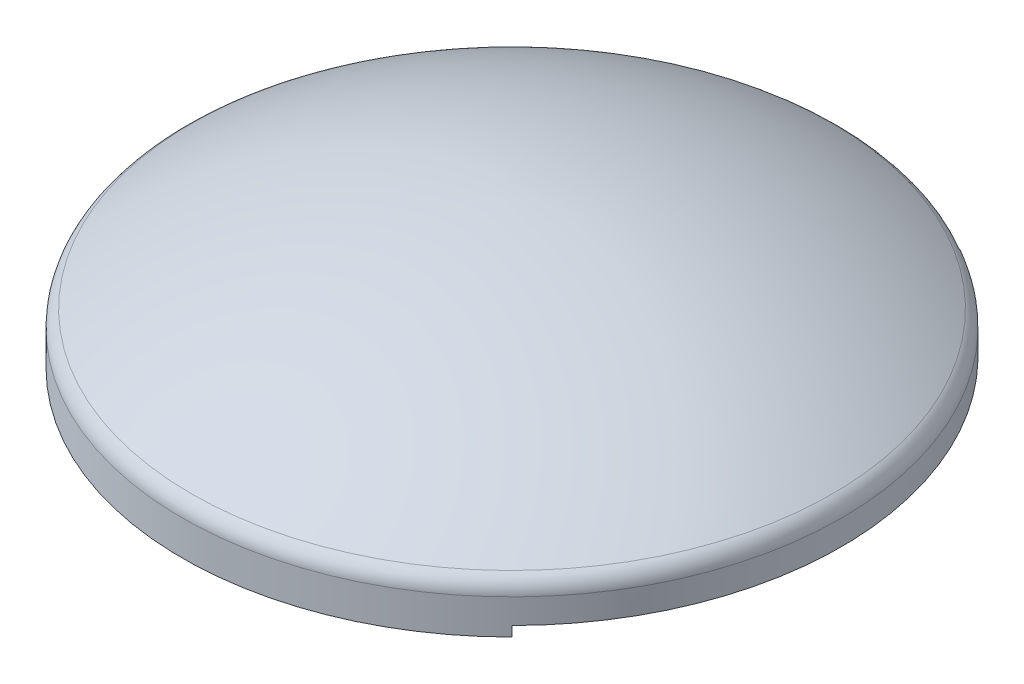
from build123d import *

# Parameters (mm, degrees)
SKETCH2_W          = 8
SKETCH2_H          = 1
CUT_REVOLVE1_ANGLE = 270
FILLET1_R          = 2
CUT_EXTRUDE1_REACH = 50.788
SKETCH3_W          = 33
SKETCH3_H          = 3.55


with BuildPart() as part:
    # Sketch1 → Revolve1 (revolve)
    with BuildSketch(Plane(origin=(0, 0, 0), x_dir=(0, 0, -1), z_dir=(1, 0, 0))):
        with BuildLine():
            Line((31.028971365, 0), (30, 0))
            Line((30, 0), (25, 0))
            Line((25, 0), (25, -1))
            Line((25, -1), (33, -1))
            Line((33, -1), (33, 3.54))
            ThreePointArc((33, 3.54), (17.288680667, 11.317287845), (0, 14.221299243))
            Line((0, 14.221299243), (0, 13.24))
            ThreePointArc((0, 13.24), (16.184761709, 10.526581268), (31.028971365, 3.529539574))
            Line((31.028971365, 3.529539574), (31.028971365, 0))
        make_face()
    revolve(axis=Axis((0, 10.04, 0), (0, -1, 0)))

    # Sketch2 → Cut-Revolve1 (revolve, symmetric, cut)
    with BuildSketch(Plane(origin=(0, 0, 0), x_dir=(0, 0, -1), z_dir=(1, 0, 0))) as cut_revolve1_sk:
        with Locations((29, -0.5)):
            Rectangle(SKETCH2_W, SKETCH2_H)
    revolve(axis=Axis((0, 10.04, 0), (0, -1, 0)), revolution_arc=CUT_REVOLVE1_ANGLE / 2, mode=Mode.SUBTRACT)
    revolve(cut_revolve1_sk.sketch, axis=Axis((0, 10.04, 0), (0, 1, 0)), revolution_arc=CUT_REVOLVE1_ANGLE / 2, mode=Mode.SUBTRACT)

    # Fillet1
    fillet1_edges = [part.edges().sort_by_distance(p)[0] for p in [
        (0, 3.54, 33),
    ]]
    fillet(fillet1_edges, radius=FILLET1_R)

    # Sketch3 → Cut-Extrude1 (cut, up to next)
    with BuildSketch(Plane.XY, mode=Mode.PRIVATE) as cut_extrude1_sk1:
        with Locations((0, 1.775)):
            Rectangle(SKETCH3_W, SKETCH3_H)
    cut_extrude1_tool1 = extrude(cut_extrude1_sk1.sketch, amount=-CUT_EXTRUDE1_REACH, mode=Mode.PRIVATE) & part.part
    add(cut_extrude1_tool1.solids().sort_by_distance((0, 1.775, 0))[0], mode=Mode.SUBTRACT)


solid = part.part
